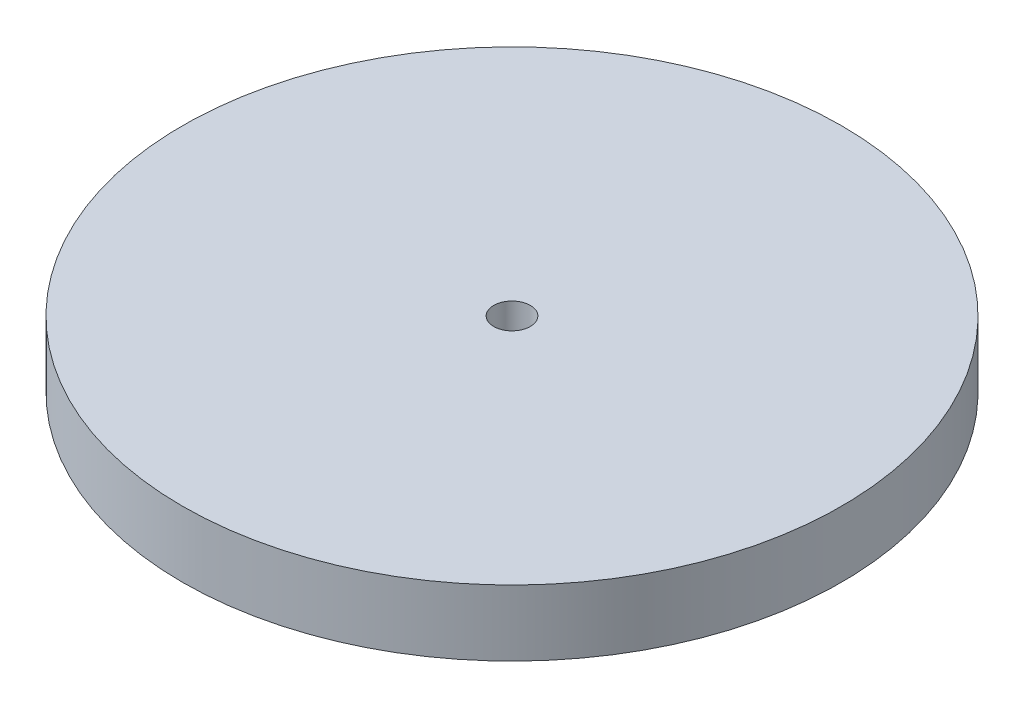
from build123d import *

# Parameters (mm, degrees)
SKETCH1_R           = 45
SKETCH1_R_2         = 2.5
BOSS_EXTRUDE1_DEPTH = 9


with BuildPart() as part:
    # Sketch1 → Boss-Extrude1 (new body)
    with BuildSketch(Plane(origin=(0, 0, 0), x_dir=(1, 0, 0), z_dir=(0, 1, 0))):
        with Locations((-14.726861043, 0)):
            Circle(SKETCH1_R)
        with Locations((-14.726861043, 0)):
            Circle(SKETCH1_R_2, mode=Mode.SUBTRACT)
    extrude(amount=BOSS_EXTRUDE1_DEPTH)


solid = part.part
